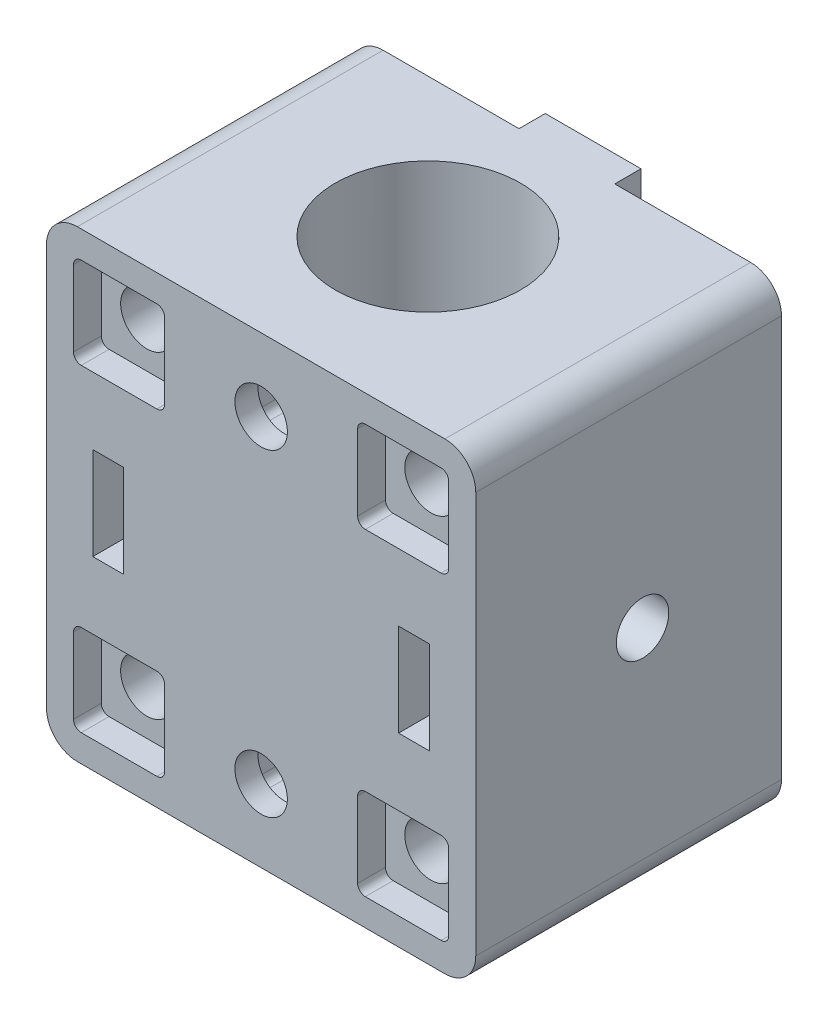
from build123d import *

# Parameters (mm, degrees)
SKETCH2_W               = 27.8
SKETCH2_H               = 18
SKETCH2_R               = 6
BOSS_EXTRUDE1_DEPTH     = 15
SKETCH7_W               = 13.9
SKETCH7_H               = 15
SKETCH7_W_2             = 5.9
SKETCH7_H_2             = 5.9
BOSS_EXTRUDE3_DEPTH     = 1.8
SKETCH8_R               = 1.7
CUT_EXTRUDE3_DEPTH      = 29.464890655
FILLET4_R               = 0.5
FILLET4_OF_MIRROR1_R    = 0.5
MIRROR2_START           = -9
MIRROR2_OUTLINE_R       = 1.7
MIRROR2_DEPTH           = 18
MIRROR2_START_2         = 9
MIRROR2_2_OUTLINE_W     = 13.9
MIRROR2_2_OUTLINE_H     = 30
MIRROR2_2_DEPTH         = 1.8
FILLET3_R               = 2
BOSS_EXTRUDE4_DEPTH     = 1.7
CUT_EXTRUDE4_REACH      = 33.173
CUT_EXTRUDE4_END_RADIUS = 6
CUT_EXTRUDE4_START      = -1.5
SKETCH10_W              = 5.9
SKETCH10_H              = 5.9
FILLET5_R               = 0.5
SKETCH11_R              = 1.7
CUT_EXTRUDE5_DEPTH      = 29.604370348
FILLET5_OF_MIRROR3_R    = 0.5
CUT_EXTRUDE6_START      = -10.8
SKETCH12_W              = 2
SKETCH12_H              = 6
CUT_EXTRUDE6_DEPTH      = 10.8
SKETCH13_W              = 2
SKETCH13_H              = 6
CUT_EXTRUDE7_DEPTH      = 2.95
CUT_EXTRUDE8_REACH      = 35.384
CUT_EXTRUDE8_END_RADIUS = 6
SKETCH14_R              = 1.7


# Read off the part's stored shape, not the designer's step: Mirror2
with BuildPart() as part:
    # Sketch2 → Boss-Extrude1 (new, symmetric)
    with BuildSketch(Plane(origin=(0, 0, 0), x_dir=(1, 0, 0), z_dir=(0, 1, 0))):
        Rectangle(SKETCH2_W, SKETCH2_H)
        with Locations(Location((0, 0, 0), (0, 0, 270))):
            Circle(SKETCH2_R, mode=Mode.SUBTRACT)
    extrude(amount=BOSS_EXTRUDE1_DEPTH, both=True)

    # Sketch7 → Boss-Extrude3 (add)
    with BuildSketch(Plane.XY.offset(9)):
        with Locations((-6.95, 7.5)):
            Rectangle(SKETCH7_W, SKETCH7_H)
        with Locations((-9.2, 10.3)):
            Rectangle(SKETCH7_W_2, SKETCH7_H_2, mode=Mode.SUBTRACT)
    boss_extrude3 = extrude(amount=BOSS_EXTRUDE3_DEPTH)

    # Sketch8 → Cut-Extrude3 (cut, through all)
    with BuildSketch(Plane.XY.offset(10.8)):
        with Locations((-9.2, 10.3)):
            Circle(SKETCH8_R)
    cut_extrude3 = extrude(amount=-CUT_EXTRUDE3_DEPTH, mode=Mode.SUBTRACT)

    # Fillet4
    fillet4_edges = [part.edges().sort_by_distance(p)[0] for p in [
        (-6.25, 13.25, 9.9),
        (-12.15, 13.25, 9.9),
        (-12.15, 7.35, 9.9),
        (-6.25, 7.35, 9.9),
    ]]
    fillet(fillet4_edges, radius=FILLET4_R)

    # Mirror1: Boss-Extrude3, Cut-Extrude3 across plane
    add(boss_extrude3.mirror(Plane.ZX))
    add(cut_extrude3.mirror(Plane.ZX), mode=Mode.SUBTRACT)

    # Fillet4 of Mirror1
    fillet4_of_mirror1_edges = [part.edges().sort_by_distance(p)[0] for p in [
        (-6.25, -13.25, 9.9),
        (-12.15, -13.25, 9.9),
        (-12.15, -7.35, 9.9),
        (-6.25, -7.35, 9.9),
    ]]
    fillet(fillet4_of_mirror1_edges, radius=FILLET4_OF_MIRROR1_R)

    # Mirror2 outline → Mirror2 (cut)
    with BuildSketch(Plane.XY.offset(MIRROR2_START)):
        with Locations((9.2, -10.3)):
            Circle(MIRROR2_OUTLINE_R)
        with Locations((9.2, 10.3)):
            Circle(MIRROR2_OUTLINE_R)
    extrude(amount=MIRROR2_DEPTH, mode=Mode.SUBTRACT)

    # Mirror2 2 outline → Mirror2 2 (add)
    with BuildSketch(Plane.XY.offset(MIRROR2_START_2)):
        with Locations((6.95, 0)):
            Rectangle(MIRROR2_2_OUTLINE_W, MIRROR2_2_OUTLINE_H)
        with BuildLine():
            ThreePointArc((6.25, -7.85), (6.396446609, -7.496446609), (6.75, -7.35))
            Line((6.75, -7.35), (11.65, -7.35))
            ThreePointArc((11.65, -7.35), (12.003553391, -7.496446609), (12.15, -7.85))
            Line((12.15, -7.85), (12.15, -12.75))
            ThreePointArc((12.15, -12.75), (12.003553391, -13.103553391), (11.65, -13.25))
            Line((11.65, -13.25), (6.75, -13.25))
            ThreePointArc((6.75, -13.25), (6.396446609, -13.103553391), (6.25, -12.75))
            Line((6.25, -12.75), (6.25, -7.85))
        make_face(mode=Mode.SUBTRACT)
        with BuildLine():
            Line((6.75, 13.25), (11.65, 13.25))
            ThreePointArc((11.65, 13.25), (12.003553391, 13.103553391), (12.15, 12.75))
            Line((12.15, 12.75), (12.15, 7.85))
            ThreePointArc((12.15, 7.85), (12.003553391, 7.496446609), (11.65, 7.35))
            Line((11.65, 7.35), (6.75, 7.35))
            ThreePointArc((6.75, 7.35), (6.396446609, 7.496446609), (6.25, 7.85))
            Line((6.25, 7.85), (6.25, 12.75))
            ThreePointArc((6.25, 12.75), (6.396446609, 13.103553391), (6.75, 13.25))
        make_face(mode=Mode.SUBTRACT)
    extrude(amount=MIRROR2_2_DEPTH)

    # Fillet3
    fillet3_edges = [part.edges().sort_by_distance(p)[0] for p in [
        (-13.9, 15, 0.9),
        (13.9, 15, 0.9),
        (-13.9, -15, 0.9),
        (13.9, -15, 0.9),
    ]]
    fillet(fillet3_edges, radius=FILLET3_R)

    # Sketch9 → Boss-Extrude4 (add)
    with BuildSketch(Plane(origin=(0, 0, -9), x_dir=(-1, 0, 0), z_dir=(0, 0, -1))):
        Polygon((-3.1, 15), (3.1, 15), (3.1, 6), (4.1, 6), (4.1, -15), (-4.1, -15), (-4.1, 6), (-3.1, 6), align=None)
    extrude(amount=BOSS_EXTRUDE4_DEPTH)

    # Cut-Extrude4: up to this cylinder (the profile starts outside it)
    cut_extrude4_end = Plane(origin=(0, 10.3, 0), z_dir=(0, -1, 0)) * Cylinder(CUT_EXTRUDE4_END_RADIUS, 79.346, mode=Mode.PRIVATE)
    # Sketch10 → Cut-Extrude4 (cut, up to the surface)
    with BuildSketch(Plane.XY.offset(10.8).offset(CUT_EXTRUDE4_START), mode=Mode.PRIVATE) as cut_extrude4_sk1:
        with Locations((0, 10.3)):
            Rectangle(SKETCH10_W, SKETCH10_H)
    cut_extrude4_tool1 = extrude(cut_extrude4_sk1.sketch, amount=-CUT_EXTRUDE4_REACH, mode=Mode.PRIVATE) - cut_extrude4_end
    cut_extrude4 = cut_extrude4_tool1.solids().sort_by_distance((0, 10.3, 9.3))[0]
    add(cut_extrude4, mode=Mode.SUBTRACT)

    # Fillet5
    fillet5_edges = [part.edges().sort_by_distance(p)[0] for p in [
        (2.95, 13.25, 7.262350474),
        (2.95, 7.35, 7.262350474),
        (-2.95, 7.35, 7.262350474),
        (-2.95, 13.25, 7.262350474),
    ]]
    fillet(fillet5_edges, radius=FILLET5_R)

    # Sketch11 → Cut-Extrude5 (cut, through all)
    with BuildSketch(Plane(origin=(0, 0, 9.3), x_dir=(-1, 0, 0), z_dir=(0, 0, -1))):
        with Locations((0, 10.3)):
            Circle(SKETCH11_R)
    cut_extrude5 = extrude(amount=-CUT_EXTRUDE5_DEPTH, mode=Mode.SUBTRACT)

    # Mirror3: Cut-Extrude4, Cut-Extrude5 across plane
    add(cut_extrude4.mirror(Plane.ZX), mode=Mode.SUBTRACT)
    add(cut_extrude5.mirror(Plane.ZX), mode=Mode.SUBTRACT)

    # Fillet5 of Mirror3
    fillet5_of_mirror3_edges = [part.edges().sort_by_distance(p)[0] for p in [
        (2.95, -13.25, 7.262350474),
        (2.95, -7.35, 7.262350474),
        (-2.95, -7.35, 7.262350474),
        (-2.95, -13.25, 7.262350474),
    ]]
    fillet(fillet5_of_mirror3_edges, radius=FILLET5_OF_MIRROR3_R)

    # Sketch12 → Cut-Extrude6 (cut)
    with BuildSketch(Plane.XY.offset(10.8).offset(CUT_EXTRUDE6_START)):
        with Locations((-9.9, 0)):
            Rectangle(SKETCH12_W, SKETCH12_H)
    cut_extrude6 = extrude(amount=CUT_EXTRUDE6_DEPTH, mode=Mode.SUBTRACT)

    # Sketch13 → Cut-Extrude7 (cut)
    with BuildSketch(Plane.XY):
        with Locations((-9.9, 0)):
            Rectangle(SKETCH13_W, SKETCH13_H)
    cut_extrude7 = extrude(amount=-CUT_EXTRUDE7_DEPTH, mode=Mode.SUBTRACT)

    # Cut-Extrude8: up to this cylinder (the profile starts outside it)
    cut_extrude8_end = Plane(origin=(0, 0, 0), z_dir=(0, -1, 0)) * Cylinder(CUT_EXTRUDE8_END_RADIUS, 83.768, mode=Mode.PRIVATE)
    # Sketch14 → Cut-Extrude8 (cut, up to the surface)
    with BuildSketch(Plane.ZY.offset(13.9), mode=Mode.PRIVATE) as cut_extrude8_sk1:
        Circle(SKETCH14_R)
    cut_extrude8_tool1 = extrude(cut_extrude8_sk1.sketch, amount=-CUT_EXTRUDE8_REACH, mode=Mode.PRIVATE) - cut_extrude8_end
    cut_extrude8 = cut_extrude8_tool1.solids().sort_by_distance((-13.9, 0, 0))[0]
    add(cut_extrude8, mode=Mode.SUBTRACT)

    # Mirror4: Cut-Extrude6, Cut-Extrude7, Cut-Extrude8 across plane
    add(cut_extrude6.mirror(Plane(origin=(0, 0, 0), x_dir=(0, 0, 1), z_dir=(1, 0, 0))), mode=Mode.SUBTRACT)
    add(cut_extrude7.mirror(Plane(origin=(0, 0, 0), x_dir=(0, 0, 1), z_dir=(1, 0, 0))), mode=Mode.SUBTRACT)
    add(cut_extrude8.mirror(Plane(origin=(0, 0, 0), x_dir=(0, 0, 1), z_dir=(1, 0, 0))), mode=Mode.SUBTRACT)


solid = part.part
